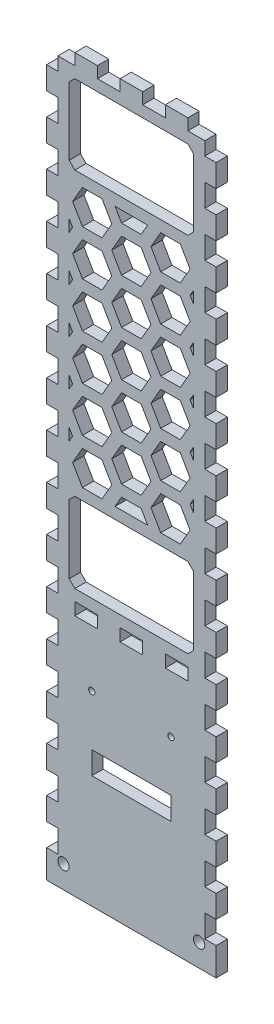
from build123d import *

# Parameters (mm, degrees)
SKETCH2_W           = 95.25
SKETCH2_H           = 305.964286483
BOSS_EXTRUDE1_DEPTH = 6.35
SKETCH3_W           = 6.35
SKETCH3_H           = 12.7
CUT_EXTRUDE1_DEPTH  = 321.51057643
LPATTERN1_COUNT     = 12
LPATTERN1_PITCH     = 25.4
SKETCH4_W           = 15.875
SKETCH4_H           = 6.374255968
SKETCH4_W_2         = 12.7
CUT_EXTRUDE2_DEPTH  = 321.51057643
SKETCH5_W           = 12.7
SKETCH5_H           = 6.929808982
CUT_EXTRUDE3_DEPTH  = 321.51057643
SKETCH8_W           = 95.25
SKETCH8_H           = 0.555553013
CUT_EXTRUDE5_DEPTH  = 321.51057643
SKETCH9_W           = 69.85
SKETCH9_H           = 248.088941691
BOSS_EXTRUDE3_DEPTH = 6.35
CUT_EXTRUDE8_DEPTH  = 321.51057643
FILL_PATTERN1_DEPTH = 6.35
SKETCH9_2_W         = 69.85
SKETCH9_2_H         = 248.088941691
CUT_EXTRUDE9_DEPTH  = 6.35
SKETCH14_W          = 69.85
SKETCH14_H          = 51.238941691
BOSS_EXTRUDE4_DEPTH = 6.35
SKETCH15_W          = 69.85
SKETCH15_H          = 44.888941691
CUT_EXTRUDE11_DEPTH = 6.35
CHAMFER1_SIZE       = 3.175
SKETCH17_W          = 69.85
SKETCH17_H          = 6.35
BOSS_EXTRUDE5_DEPTH = 6.35
SKETCH18_W          = 69.85
SKETCH18_H          = 44.45
CUT_EXTRUDE12_DEPTH = 321.51057643
CHAMFER2_SIZE       = 3.175
SKETCH19_W          = 95.25
SKETCH19_H          = 105.239375395
BOSS_EXTRUDE6_DEPTH = 6.35
LPATTERN2_COUNT     = 5
LPATTERN2_PITCH     = 25.4
SKETCH20_R          = 3.175
CUT_EXTRUDE13_DEPTH = 321.51057643
SKETCH22_R          = 1.75
CUT_EXTRUDE14_DEPTH = 321.51057643
SKETCH23_W          = 44.45
SKETCH23_H          = 12.7
CUT_EXTRUDE15_DEPTH = 321.51057643


# Read off the part's stored shape, not the designer's step: Fill Pattern1
with BuildPart() as part:
    # Sketch2 → Boss-Extrude1 (new body)
    with BuildSketch(Plane.XY):
        with Locations((47.625, 152.982143242)):
            Rectangle(SKETCH2_W, SKETCH2_H)
    extrude(amount=BOSS_EXTRUDE1_DEPTH)

    # Sketch3 → Cut-Extrude1 (cut, through all)
    with BuildSketch(Plane.XY.offset(6.35)):
        with Locations((3.175, 19.05)):
            Rectangle(SKETCH3_W, SKETCH3_H)
        with Locations((92.075, 19.05)):
            Rectangle(SKETCH3_W, SKETCH3_H)
    cut_extrude1 = extrude(amount=-CUT_EXTRUDE1_DEPTH, mode=Mode.SUBTRACT)

    # LPattern1: Cut-Extrude1 ×12
    with Locations(*[(0, i * LPATTERN1_PITCH, 0) for i in range(1, LPATTERN1_COUNT)]):
        add(cut_extrude1, mode=Mode.SUBTRACT)

    # Sketch4 → Cut-Extrude2 (cut, through all)
    with BuildSketch(Plane.XY.offset(6.35)):
        with Locations((7.9375, 302.777158499)):
            Rectangle(SKETCH4_W, SKETCH4_H)
        with Locations((34.925, 302.777158499)):
            Rectangle(SKETCH4_W_2, SKETCH4_H)
        with Locations((87.3125, 302.777158499)):
            Rectangle(SKETCH4_W, SKETCH4_H)
        with Locations((60.325, 302.777158499)):
            Rectangle(SKETCH4_W_2, SKETCH4_H)
    extrude(amount=-CUT_EXTRUDE2_DEPTH, mode=Mode.SUBTRACT)

    # Sketch5 → Cut-Extrude3 (cut, through all)
    with BuildSketch(Plane.XY.offset(6.35)):
        with Locations((22.225, 35.336184333)):
            Rectangle(SKETCH5_W, SKETCH5_H)
        with Locations((47.625, 35.336184333)):
            Rectangle(SKETCH5_W, SKETCH5_H)
        with Locations((73.025, 35.336184333)):
            Rectangle(SKETCH5_W, SKETCH5_H)
    extrude(amount=-CUT_EXTRUDE3_DEPTH, mode=Mode.SUBTRACT)

    # Sketch8 → Cut-Extrude5 (cut, through all)
    with BuildSketch(Plane.XY.offset(6.35)):
        with Locations((47.625, 0.277776507)):
            Rectangle(SKETCH8_W, SKETCH8_H)
    extrude(amount=-CUT_EXTRUDE5_DEPTH, mode=Mode.SUBTRACT)

    # Sketch9<2> → Cut-Extrude9 (cut)
    with BuildSketch(Plane.XY.offset(6.35)):
        with Locations((47.625, 169.195559669)):
            Rectangle(SKETCH9_2_W, SKETCH9_2_H)
    extrude(amount=-CUT_EXTRUDE9_DEPTH, mode=Mode.SUBTRACT)


with BuildPart() as body_2:
    # Sketch9 → Boss-Extrude3 (new body)
    with BuildSketch(Plane.XY.offset(6.35)):
        with Locations((47.625, 169.195559669)):
            Rectangle(SKETCH9_W, SKETCH9_H)
    extrude(amount=-BOSS_EXTRUDE3_DEPTH)

    # Sketch12 → Cut-Extrude8 (cut, through all)
    with BuildSketch(Plane.XY.offset(6.35)):
        Polygon((42.125738686, 280.540030515), (36.626477372, 271.015030515), (42.125738686, 261.490030515), (53.124261314, 261.490030515), (58.623522628, 271.015030515), (53.124261314, 280.540030515), align=None)
    extrude(amount=-CUT_EXTRUDE8_DEPTH, mode=Mode.SUBTRACT)

    # Fill Pattern1 outline → Fill Pattern1 (cut)
    with BuildSketch(Plane.XY):
        Polygon((75.12130657, 223.390030515), (80.620567884, 232.915030515), (75.12130657, 242.440030515), (64.122783942, 242.440030515), (58.623522628, 232.915030515), (64.122783942, 223.390030515), align=None)
        Polygon((20.12869343, 223.390030515), (31.127216058, 223.390030515), (36.626477372, 232.915030515), (31.127216058, 242.440030515), (20.12869343, 242.440030515), (14.629432116, 232.915030515), align=None)
        Polygon((12.7, 198.156904969), (12.7, 191.47315606), (14.629432116, 194.815030515), align=None)
        Polygon((14.629432116, 169.415030515), (12.7, 172.756904969), (12.7, 166.07315606), align=None)
        Polygon((12.7, 223.556904969), (12.7, 216.87315606), (14.629432116, 220.215030515), align=None)
        Polygon((14.629432116, 144.015030515), (12.7, 147.356904969), (12.7, 140.67315606), align=None)
        Polygon((12.7, 248.956904969), (12.7, 242.27315606), (14.629432116, 245.615030515), align=None)
        Polygon((14.629432116, 118.615030515), (12.7, 121.956904969), (12.7, 115.27315606), align=None)
        Polygon((12.7, 274.356904969), (12.7, 267.67315606), (14.629432116, 271.015030515), align=None)
        Polygon((14.629432116, 93.215030515), (12.7, 96.556904969), (12.7, 89.87315606), align=None)
        Polygon((12.7, 293.240030515), (12.7, 293.07315606), (12.796345011, 293.240030515), align=None)
        Polygon((14.629432116, 67.815030515), (12.7, 71.156904969), (12.7, 64.47315606), align=None)
        Polygon((31.127216058, 293.240030515), (20.12869343, 293.240030515), (14.629432116, 283.715030515), (20.12869343, 274.190030515), (31.127216058, 274.190030515), (36.626477372, 283.715030515), align=None)
        Polygon((56.790435523, 293.240030515), (38.459564477, 293.240030515), (42.125738686, 286.890030515), (53.124261314, 286.890030515), align=None)
        Polygon((42.125738686, 51.940030515), (38.206141373, 45.151088824), (57.043858627, 45.151088824), (53.124261314, 51.940030515), align=None)
        Polygon((75.12130657, 293.240030515), (64.122783942, 293.240030515), (58.623522628, 283.715030515), (64.122783942, 274.190030515), (75.12130657, 274.190030515), (80.620567884, 283.715030515), align=None)
        Polygon((82.55, 45.756904969), (82.200231885, 45.151088824), (82.55, 45.151088824), align=None)
        Polygon((82.55, 293.240030515), (82.453654989, 293.240030515), (82.55, 293.07315606), align=None)
        Polygon((80.620567884, 67.815030515), (82.55, 64.47315606), (82.55, 71.156904969), align=None)
        Polygon((82.55, 267.67315606), (82.55, 274.356904969), (80.620567884, 271.015030515), align=None)
        Polygon((80.620567884, 93.215030515), (82.55, 89.87315606), (82.55, 96.556904969), align=None)
        Polygon((82.55, 242.27315606), (82.55, 248.956904969), (80.620567884, 245.615030515), align=None)
        Polygon((80.620567884, 118.615030515), (82.55, 115.27315606), (82.55, 121.956904969), align=None)
        Polygon((82.55, 216.87315606), (82.55, 223.556904969), (80.620567884, 220.215030515), align=None)
        Polygon((80.620567884, 144.015030515), (82.55, 140.67315606), (82.55, 147.356904969), align=None)
        Polygon((82.55, 191.47315606), (82.55, 198.156904969), (80.620567884, 194.815030515), align=None)
        Polygon((80.620567884, 169.415030515), (82.55, 166.07315606), (82.55, 172.756904969), align=None)
        Polygon((20.12869343, 248.790030515), (31.127216058, 248.790030515), (36.626477372, 258.315030515), (31.127216058, 267.840030515), (20.12869343, 267.840030515), (14.629432116, 258.315030515), align=None)
        Polygon((64.122783942, 267.840030515), (58.623522628, 258.315030515), (64.122783942, 248.790030515), (75.12130657, 248.790030515), (80.620567884, 258.315030515), (75.12130657, 267.840030515), align=None)
        Polygon((42.125738686, 236.090030515), (53.124261314, 236.090030515), (58.623522628, 245.615030515), (53.124261314, 255.140030515), (42.125738686, 255.140030515), (36.626477372, 245.615030515), align=None)
        Polygon((20.12869343, 197.990030515), (31.127216058, 197.990030515), (36.626477372, 207.515030515), (31.127216058, 217.040030515), (20.12869343, 217.040030515), (14.629432116, 207.515030515), align=None)
        Polygon((53.124261314, 204.340030515), (42.125738686, 204.340030515), (36.626477372, 194.815030515), (42.125738686, 185.290030515), (53.124261314, 185.290030515), (58.623522628, 194.815030515), align=None)
        Polygon((31.127216058, 166.240030515), (20.12869343, 166.240030515), (14.629432116, 156.715030515), (20.12869343, 147.190030515), (31.127216058, 147.190030515), (36.626477372, 156.715030515), align=None)
        Polygon((75.12130657, 197.990030515), (80.620567884, 207.515030515), (75.12130657, 217.040030515), (64.122783942, 217.040030515), (58.623522628, 207.515030515), (64.122783942, 197.990030515), align=None)
        Polygon((42.125738686, 210.690030515), (53.124261314, 210.690030515), (58.623522628, 220.215030515), (53.124261314, 229.740030515), (42.125738686, 229.740030515), (36.626477372, 220.215030515), align=None)
        Polygon((20.12869343, 172.590030515), (31.127216058, 172.590030515), (36.626477372, 182.115030515), (31.127216058, 191.640030515), (20.12869343, 191.640030515), (14.629432116, 182.115030515), align=None)
        Polygon((53.124261314, 178.940030515), (42.125738686, 178.940030515), (36.626477372, 169.415030515), (42.125738686, 159.890030515), (53.124261314, 159.890030515), (58.623522628, 169.415030515), align=None)
        Polygon((31.127216058, 140.840030515), (20.12869343, 140.840030515), (14.629432116, 131.315030515), (20.12869343, 121.790030515), (31.127216058, 121.790030515), (36.626477372, 131.315030515), align=None)
        Polygon((75.12130657, 147.190030515), (80.620567884, 156.715030515), (75.12130657, 166.240030515), (64.122783942, 166.240030515), (58.623522628, 156.715030515), (64.122783942, 147.190030515), align=None)
        Polygon((75.12130657, 172.590030515), (80.620567884, 182.115030515), (75.12130657, 191.640030515), (64.122783942, 191.640030515), (58.623522628, 182.115030515), (64.122783942, 172.590030515), align=None)
        Polygon((53.124261314, 153.540030515), (42.125738686, 153.540030515), (36.626477372, 144.015030515), (42.125738686, 134.490030515), (53.124261314, 134.490030515), (58.623522628, 144.015030515), align=None)
        Polygon((31.127216058, 115.440030515), (20.12869343, 115.440030515), (14.629432116, 105.915030515), (20.12869343, 96.390030515), (31.127216058, 96.390030515), (36.626477372, 105.915030515), align=None)
        Polygon((75.12130657, 121.790030515), (80.620567884, 131.315030515), (75.12130657, 140.840030515), (64.122783942, 140.840030515), (58.623522628, 131.315030515), (64.122783942, 121.790030515), align=None)
        Polygon((53.124261314, 128.140030515), (42.125738686, 128.140030515), (36.626477372, 118.615030515), (42.125738686, 109.090030515), (53.124261314, 109.090030515), (58.623522628, 118.615030515), align=None)
        Polygon((31.127216058, 90.040030515), (20.12869343, 90.040030515), (14.629432116, 80.515030515), (20.12869343, 70.990030515), (31.127216058, 70.990030515), (36.626477372, 80.515030515), align=None)
        Polygon((75.12130657, 96.390030515), (80.620567884, 105.915030515), (75.12130657, 115.440030515), (64.122783942, 115.440030515), (58.623522628, 105.915030515), (64.122783942, 96.390030515), align=None)
        Polygon((53.124261314, 102.740030515), (42.125738686, 102.740030515), (36.626477372, 93.215030515), (42.125738686, 83.690030515), (53.124261314, 83.690030515), (58.623522628, 93.215030515), align=None)
        Polygon((31.127216058, 64.640030515), (20.12869343, 64.640030515), (14.629432116, 55.115030515), (20.12869343, 45.590030515), (31.127216058, 45.590030515), (36.626477372, 55.115030515), align=None)
        Polygon((75.12130657, 70.990030515), (80.620567884, 80.515030515), (75.12130657, 90.040030515), (64.122783942, 90.040030515), (58.623522628, 80.515030515), (64.122783942, 70.990030515), align=None)
        Polygon((53.124261314, 77.340030515), (42.125738686, 77.340030515), (36.626477372, 67.815030515), (42.125738686, 58.290030515), (53.124261314, 58.290030515), (58.623522628, 67.815030515), align=None)
        Polygon((75.12130657, 45.590030515), (80.620567884, 55.115030515), (75.12130657, 64.640030515), (64.122783942, 64.640030515), (58.623522628, 55.115030515), (64.122783942, 45.590030515), align=None)
    extrude(amount=FILL_PATTERN1_DEPTH, mode=Mode.SUBTRACT)

    # Combine1: union part
    add(part.part)

    # Sketch14 → Boss-Extrude4 (add, through all)
    with BuildSketch(Plane.XY.offset(6.35)):
        with Locations((47.625, 70.77055967)):
            Rectangle(SKETCH14_W, SKETCH14_H)
    extrude(amount=-BOSS_EXTRUDE4_DEPTH)

    # Sketch15 → Cut-Extrude11 (cut)
    with BuildSketch(Plane.XY.offset(6.35)):
        with Locations((47.625, 67.59555967)):
            Rectangle(SKETCH15_W, SKETCH15_H)
    extrude(amount=-CUT_EXTRUDE11_DEPTH, mode=Mode.SUBTRACT)

    # Chamfer1
    chamfer1_edges = [body_2.edges().sort_by_distance(p)[0] for p in [
        (12.7, 45.151088824, 3.175),
        (12.7, 90.040030515, 3.175),
        (82.55, 90.040030515, 3.175),
        (82.55, 45.151088824, 3.175),
    ]]
    chamfer(chamfer1_edges, length=CHAMFER1_SIZE)

    # Sketch17 → Boss-Extrude5 (add, through all)
    with BuildSketch(Plane.XY.offset(6.35)):
        with Locations((47.625, 245.615030515)):
            Rectangle(SKETCH17_W, SKETCH17_H)
    extrude(amount=-BOSS_EXTRUDE5_DEPTH)

    # Sketch18 → Cut-Extrude12 (cut, through all)
    with BuildSketch(Plane.XY.offset(6.35)):
        with Locations((47.625, 271.015030515)):
            Rectangle(SKETCH18_W, SKETCH18_H)
    extrude(amount=-CUT_EXTRUDE12_DEPTH, mode=Mode.SUBTRACT)

    # Chamfer2
    chamfer2_edges = [body_2.edges().sort_by_distance(p)[0] for p in [
        (82.55, 293.240030515, 3.175),
        (12.7, 293.240030515, 3.175),
        (12.7, 248.790030515, 3.175),
        (82.55, 248.790030515, 3.175),
    ]]
    chamfer(chamfer2_edges, length=CHAMFER2_SIZE)

    # Sketch19 → Boss-Extrude6 (add)
    with BuildSketch(Plane.XY.offset(6.35)):
        with Locations((47.625, -52.064134685)):
            Rectangle(SKETCH19_W, SKETCH19_H)
    extrude(amount=-BOSS_EXTRUDE6_DEPTH)

    # LPattern2: Cut-Extrude1 ×5
    with Locations(*[(0, -i * LPATTERN2_PITCH, 0) for i in range(1, LPATTERN2_COUNT)]):
        add(cut_extrude1, mode=Mode.SUBTRACT)

    # Sketch20 → Cut-Extrude13 (cut, through all)
    with BuildSketch(Plane.XY.offset(6.35)):
        with Locations((9.525, -91.983822382)):
            Circle(SKETCH20_R)
        with Locations((85.725, -91.983822382)):
            Circle(SKETCH20_R)
    extrude(amount=-CUT_EXTRUDE13_DEPTH, mode=Mode.SUBTRACT)

    # Sketch22 → Cut-Extrude14 (cut, through all)
    with BuildSketch(Plane.XY.offset(6.35)):
        with Locations((25.4, 0)):
            Circle(SKETCH22_R)
        with Locations((69.85, 0)):
            Circle(SKETCH22_R)
    extrude(amount=-CUT_EXTRUDE14_DEPTH, mode=Mode.SUBTRACT)

    # Sketch23 → Cut-Extrude15 (cut, through all)
    with BuildSketch(Plane.XY.offset(6.35)):
        with Locations((47.625, -34.833822382)):
            Rectangle(SKETCH23_W, SKETCH23_H)
    extrude(amount=-CUT_EXTRUDE15_DEPTH, mode=Mode.SUBTRACT)


solid = body_2.part
